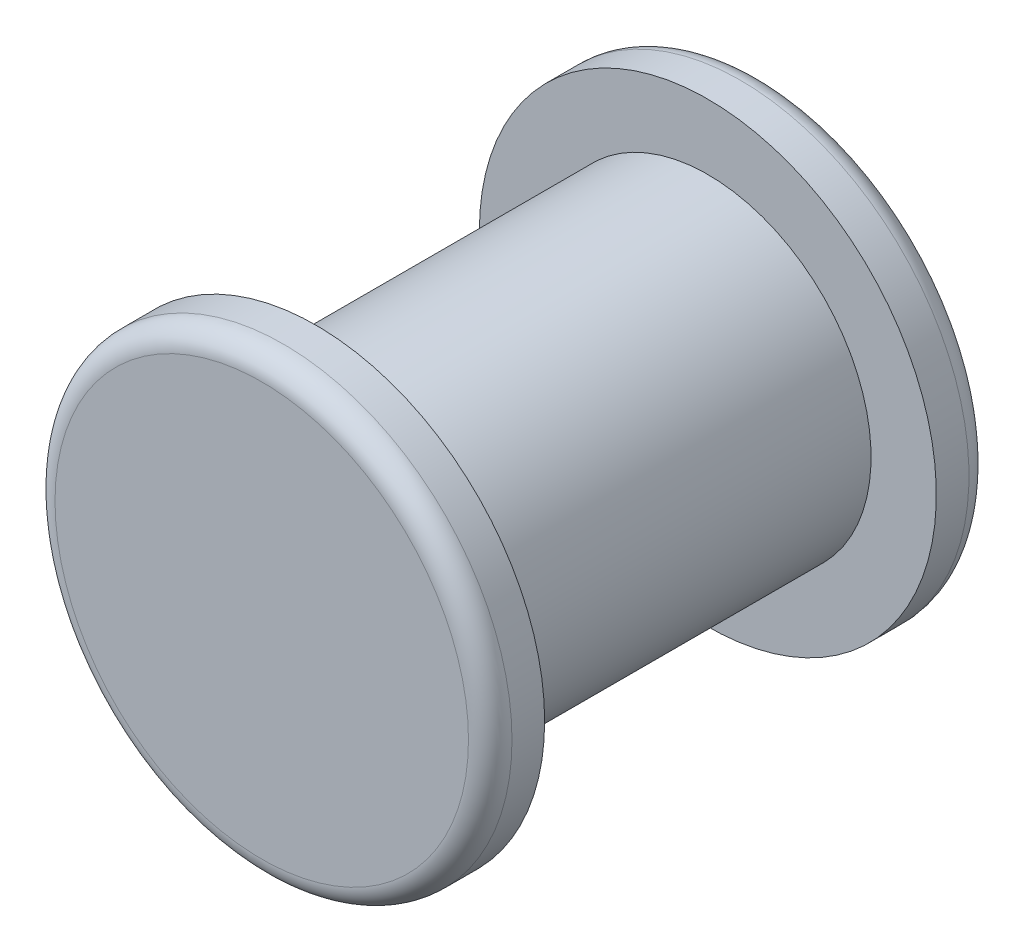
from build123d import *

# Parameters (mm, degrees)
SKETCH1_R           = 75
BOSS_EXTRUDE1_DEPTH = 180
SKETCH2_R           = 105
BOSS_EXTRUDE2_DEPTH = 25
BOSS_EXTRUDE3_START = 25
SKETCH3_R           = 105
BOSS_EXTRUDE3_DEPTH = 25
FILLET1_R           = 10


with BuildPart() as part:
    # Sketch1 → Boss-Extrude1 (new body)
    with BuildSketch(Plane.XY):
        Circle(SKETCH1_R)
    extrude(amount=BOSS_EXTRUDE1_DEPTH)

    # Sketch2 → Boss-Extrude2 (add)
    with BuildSketch(Plane.XY.offset(180)):
        Circle(SKETCH2_R)
    extrude(amount=BOSS_EXTRUDE2_DEPTH)

    # Sketch3 → Boss-Extrude3 (add)
    with BuildSketch(Plane(origin=(0, 0, 0), x_dir=(-1, 0, 0), z_dir=(0, 0, -1)).offset(BOSS_EXTRUDE3_START)):
        Circle(SKETCH3_R)
    extrude(amount=-BOSS_EXTRUDE3_DEPTH)

    # Fillet1
    fillet1_edges = [part.edges().sort_by_distance(p)[0] for p in [
        (-105, 0, 205),
        (105, 0, -25),
    ]]
    fillet(fillet1_edges, radius=FILLET1_R)


solid = part.part
